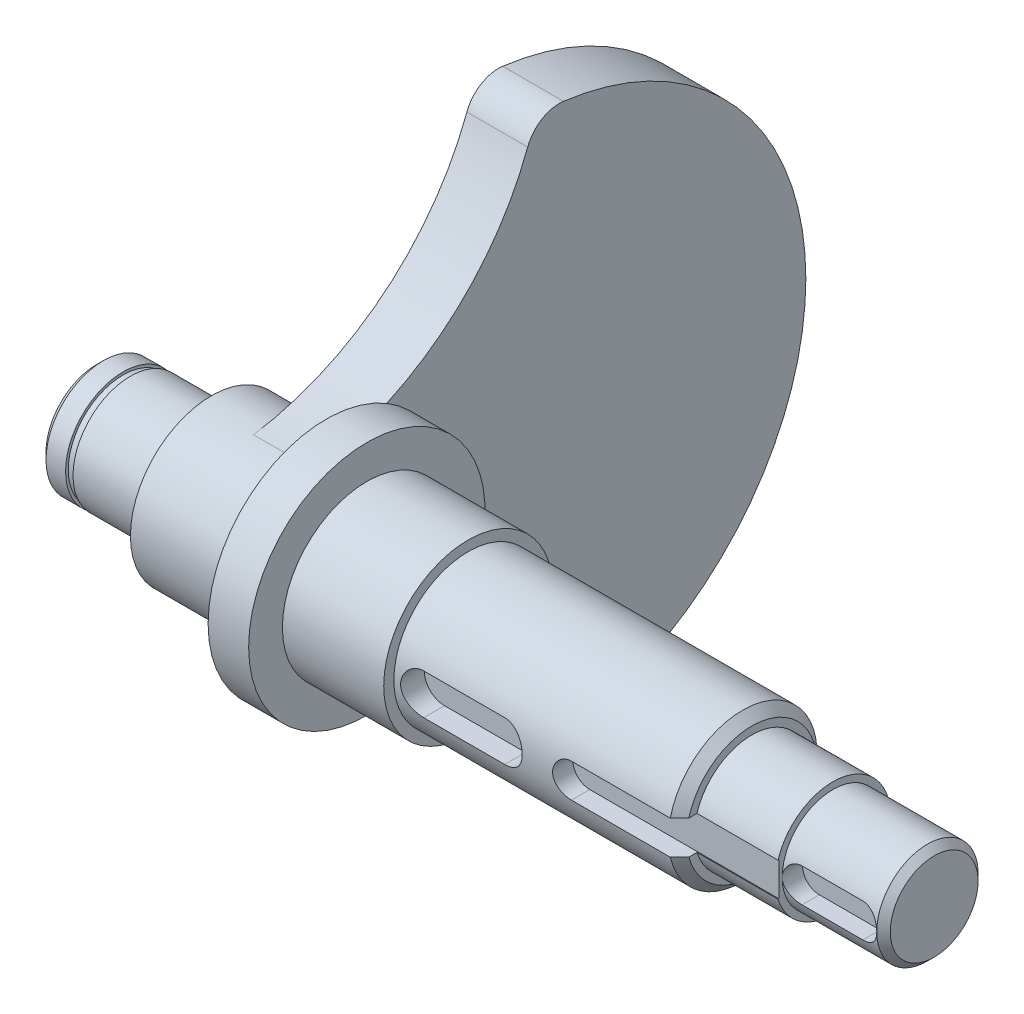
from build123d import *

# Parameters (mm, degrees)
EXTRUDE_1_DEPTH     = 9
CUT_EXTRUDE_START   = 7.5
CUT_EXTRUDE_1_DEPTH = 142.076331988
CUT_EXTRUDE_START_2 = 8
CUT_EXTRUDE_2_DEPTH = 141.576331988
CUT_EXTRUDE_START_3 = 4.5
CUT_EXTRUDE_3_DEPTH = 145.076331988
CHAMFER_1_SIZE      = 1


# Read off the part's stored shape, not the designer's step: M22 机械螺纹 螺柱1
with BuildPart() as part:
    # 草图1 → 旋转1 (revolve)
    with BuildSketch(Plane.XY, mode=Mode.PRIVATE) as revolve_1_sk:
        Polygon((0, 0), (0, 8.5), (3.9, 8.5), (3.9, 8.1), (5, 8.1), (5, 8.5), (17, 8.5), (17, 12), (34, 12), (34, 17.5), (40, 17.5), (40, 12.5), (55, 12.5), (55, 11), (97, 11), (97, 8.5), (109, 8.5), (109, 7.5), (124, 7.5), (124, 0), align=None)
    revolve(revolve_1_sk.sketch.rotate(Axis((0, 0, 0), (1, 0, 0)), 90), axis=Axis((0, 0, 0), (1, 0, 0)))

    # 草图2 → 凸台-拉伸1 (add)
    with BuildSketch(Plane.ZY.offset(-34)):
        with BuildLine():
            ThreePointArc((1.769346299, -11.868842137), (-12, 0), (1.769346299, 11.868842137))
            ThreePointArc((1.769346299, 11.868842137), (-17.516638735, 20.354713861), (-29.814759189, 37.463643428))
            ThreePointArc((-29.814759189, 37.463643428), (-31.910579937, 39.994896928), (-35.125, 40.678426408))
            ThreePointArc((-35.125, 40.678426408), (-71, 0), (-35.125, -40.678426408))
            ThreePointArc((-35.125, -40.678426408), (-31.910579937, -39.994896928), (-29.814759189, -37.463643428))
            ThreePointArc((-29.814759189, -37.463643428), (-17.516638735, -20.354713861), (1.769346299, -11.868842137))
        make_face()
    extrude(amount=EXTRUDE_1_DEPTH)

    # 草图3 → 切除-拉伸1 (cut, through all)
    with BuildSketch(Plane.XY.offset(CUT_EXTRUDE_START)):
        with BuildLine():
            Line((59, 3), (71, 3))
            ThreePointArc((71, 3), (74, 0), (71, -3))
            Line((71, -3), (59, -3))
            ThreePointArc((59, -3), (56, 0), (59, 3))
        make_face()
    extrude(amount=CUT_EXTRUDE_1_DEPTH, mode=Mode.SUBTRACT)

    # M22 机械螺纹 螺柱1 outline → M22 机械螺纹 螺柱1 (revolve, cut)
    with BuildSketch(Plane.YX):
        Polygon((11, 97), (9.647, 97), (11, 95.647), align=None)
    revolve(axis=Axis((0, 0, 0), (1, 0, 0)), mode=Mode.SUBTRACT)

    # 草图4 → 切除-拉伸2 (cut, through all)
    with BuildSketch(Plane.XY.offset(CUT_EXTRUDE_START_2)):
        with BuildLine():
            Line((81, 2.5), (110.572522736, 2.5))
            ThreePointArc((110.572522736, 2.5), (113.072522736, 0), (110.572522736, -2.5))
            Line((110.572522736, -2.5), (81, -2.5))
            ThreePointArc((81, -2.5), (78.5, 0), (81, 2.5))
        make_face()
    extrude(amount=CUT_EXTRUDE_2_DEPTH, mode=Mode.SUBTRACT)

    # 草图6 → 切除-拉伸3 (cut, through all)
    with BuildSketch(Plane.XY.offset(CUT_EXTRUDE_START_3)):
        with BuildLine():
            Line((111.5, 2.5), (120.5, 2.5))
            ThreePointArc((120.5, 2.5), (123, 0), (120.5, -2.5))
            Line((120.5, -2.5), (111.5, -2.5))
            ThreePointArc((111.5, -2.5), (109, 0), (111.5, 2.5))
        make_face()
    extrude(amount=CUT_EXTRUDE_3_DEPTH, mode=Mode.SUBTRACT)

    # 倒角1
    chamfer_1_edges = [part.edges().sort_by_distance(p)[0] for p in [
        (124, 0, -7.5),
        (0, 0, -8.5),
    ]]
    chamfer(chamfer_1_edges, length=CHAMFER_1_SIZE)


solid = part.part
